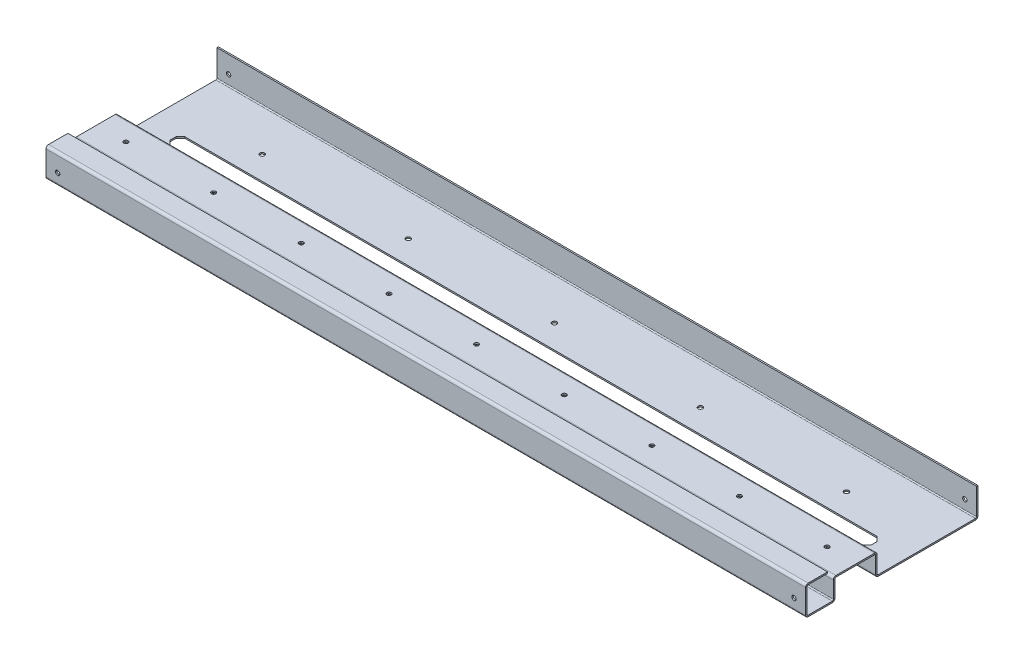
from build123d import *

# Parameters (mm, degrees)
SKETCH2_W                     = 520
SKETCH2_H                     = 70
BASE_FLANGE1_DEPTH            = 1
EDGE_FLANGE4_STRIP_W          = 5.4732
EDGE_FLANGE4_STRIP_H          = 1
EDGE_FLANGE4_STRIP_CUT_DEPTH  = 520
EDGE_FLANGE4_DEPTH            = 520
EDGE_FLANGE5_STRIP_W          = 5.4732
EDGE_FLANGE5_STRIP_H          = 1
EDGE_FLANGE5_STRIP_CUT_DEPTH  = 520
EDGE_FLANGE5_DEPTH            = 520
EDGE_FLANGE6_STRIP_W          = 5.4732
EDGE_FLANGE6_STRIP_H          = 1
EDGE_FLANGE6_STRIP_CUT_DEPTH  = 520
EDGE_FLANGE6_DEPTH            = 520
EDGE_FLANGE7_STRIP_W          = 5.4732
EDGE_FLANGE7_STRIP_H          = 1
EDGE_FLANGE7_STRIP_CUT_DEPTH  = 520
EDGE_FLANGE7_DEPTH            = 520
EDGE_FLANGE8_STRIP_W          = 5.4732
EDGE_FLANGE8_STRIP_H          = 1
EDGE_FLANGE8_STRIP_CUT_DEPTH  = 520
EDGE_FLANGE8_DEPTH            = 520
EDGE_FLANGE9_STRIP_W          = 5.4732
EDGE_FLANGE9_STRIP_H          = 1
EDGE_FLANGE9_STRIP_CUT_DEPTH  = 520
EDGE_FLANGE9_DEPTH            = 520
CUT_EXTRUDE2_REACH            = 527.071
CUT_EXTRUDE3_REACH            = 527.071
SKETCH38_R                    = 1.6
EDGE_FLANGE10_STRIP_W         = 5.4732
EDGE_FLANGE10_STRIP_H         = 1
EDGE_FLANGE10_STRIP_CUT_DEPTH = 520
EDGE_FLANGE10_DEPTH           = 520
HOLE1_START                   = 47
HOLE1_OUTLINE_R               = 1.5
HOLE1_DEPTH                   = 1
HOLE2_START                   = 47
HOLE2_OUTLINE_R               = 1.5
HOLE2_DEPTH                   = 1
HOLE3_START                   = -70
HOLE3_OUTLINE_R               = 1.5
HOLE3_DEPTH                   = 1
HOLE4_START                   = -70
HOLE4_OUTLINE_R               = 1.5
HOLE4_DEPTH                   = 1
SKETCH47_R                    = 1.5
CUT_EXTRUDE4_DEPTH            = 3


# Read off the part's stored shape, not the designer's step: Hole1, Hole2, Hole3, Hole4
# Sheet-metal steps are written as plain solids
with BuildPart() as part:
    # Sketch2 → Base-Flange1 (new body)
    with BuildSketch(Plane(origin=(0, 0, 0), x_dir=(1, 0, 0), z_dir=(0, 1, 0))):
        with Locations((260, 35)):
            Rectangle(SKETCH2_W, SKETCH2_H)
    extrude(amount=-BASE_FLANGE1_DEPTH)

    # Edge-Flange4 strip (across the edge) → Edge-Flange4 strip cut (cut)
    with BuildSketch(Plane(origin=(0, 0, 0), x_dir=(0, 0, -1), z_dir=(1, 0, 0))):
        with Locations((-1, -0.5)):
            Rectangle(EDGE_FLANGE4_STRIP_W, EDGE_FLANGE4_STRIP_H)
    extrude(amount=EDGE_FLANGE4_STRIP_CUT_DEPTH, mode=Mode.SUBTRACT)

    # Edge-Flange4 section (across the edge) → Edge-Flange4 (add)
    with BuildSketch(Plane(origin=(0, 0, 0), x_dir=(0, 0, -1), z_dir=(1, 0, 0))):
        with BuildLine():
            Line((0, 0.7366), (0, 14))
            Line((0, 14), (1, 14))
            Line((1, 14), (1, 0.7366))
            ThreePointArc((1, 0.7366), (1.215745145, 0.215745145), (1.7366, 0))
            Line((1.7366, 0), (1.7366, -1))
            ThreePointArc((1.7366, -1), (0.508638364, -0.491361636), (0, 0.7366))
        make_face()
    extrude(amount=EDGE_FLANGE4_DEPTH)

    # Edge-Flange5 strip (across the edge) → Edge-Flange5 strip cut (cut)
    with BuildSketch(Plane(origin=(520, 14, 0), x_dir=(0, -1, 0), z_dir=(-1, 0, 0))):
        with Locations((-1, -0.5)):
            Rectangle(EDGE_FLANGE5_STRIP_W, EDGE_FLANGE5_STRIP_H)
    extrude(amount=EDGE_FLANGE5_STRIP_CUT_DEPTH, mode=Mode.SUBTRACT)

    # Edge-Flange5 section (across the edge) → Edge-Flange5 (add)
    with BuildSketch(Plane(origin=(520, 14, 0), x_dir=(0, -1, 0), z_dir=(-1, 0, 0))):
        with BuildLine():
            Line((0, 0.7366), (0, 29))
            Line((0, 29), (1, 29))
            Line((1, 29), (1, 0.7366))
            ThreePointArc((1, 0.7366), (1.215745145, 0.215745145), (1.7366, 0))
            Line((1.7366, 0), (1.7366, -1))
            ThreePointArc((1.7366, -1), (0.508638364, -0.491361636), (0, 0.7366))
        make_face()
    extrude(amount=EDGE_FLANGE5_DEPTH)

    # Edge-Flange6 strip (across the edge) → Edge-Flange6 strip cut (cut)
    with BuildSketch(Plane(origin=(520, 13, 29), x_dir=(0, 0, -1), z_dir=(-1, 0, 0))):
        with Locations((-1, -0.5)):
            Rectangle(EDGE_FLANGE6_STRIP_W, EDGE_FLANGE6_STRIP_H)
    extrude(amount=EDGE_FLANGE6_STRIP_CUT_DEPTH, mode=Mode.SUBTRACT)

    # Edge-Flange6 section (across the edge) → Edge-Flange6 (add)
    with BuildSketch(Plane(origin=(520, 13, 29), x_dir=(0, 0, -1), z_dir=(-1, 0, 0))):
        with BuildLine():
            Line((0, 0.7366), (0, 14))
            Line((0, 14), (1, 14))
            Line((1, 14), (1, 0.7366))
            ThreePointArc((1, 0.7366), (1.215745145, 0.215745145), (1.7366, 0))
            Line((1.7366, 0), (1.7366, -1))
            ThreePointArc((1.7366, -1), (0.508638364, -0.491361636), (0, 0.7366))
        make_face()
    extrude(amount=EDGE_FLANGE6_DEPTH)

    # Edge-Flange7 strip (across the edge) → Edge-Flange7 strip cut (cut)
    with BuildSketch(Plane(origin=(0, -1, 29), x_dir=(0, 1, 0), z_dir=(1, 0, 0))):
        with Locations((-1, -0.5)):
            Rectangle(EDGE_FLANGE7_STRIP_W, EDGE_FLANGE7_STRIP_H)
    extrude(amount=EDGE_FLANGE7_STRIP_CUT_DEPTH, mode=Mode.SUBTRACT)

    # Edge-Flange7 section (across the edge) → Edge-Flange7 (add)
    with BuildSketch(Plane(origin=(0, -1, 29), x_dir=(0, 1, 0), z_dir=(1, 0, 0))):
        with BuildLine():
            Line((0, 0.7366), (0, 19))
            Line((0, 19), (1, 19))
            Line((1, 19), (1, 0.7366))
            ThreePointArc((1, 0.7366), (1.215745145, 0.215745145), (1.7366, 0))
            Line((1.7366, 0), (1.7366, -1))
            ThreePointArc((1.7366, -1), (0.508638364, -0.491361636), (0, 0.7366))
        make_face()
    extrude(amount=EDGE_FLANGE7_DEPTH)

    # Edge-Flange8 strip (across the edge) → Edge-Flange8 strip cut (cut)
    with BuildSketch(Plane(origin=(0, 0, 48), x_dir=(0, 0, -1), z_dir=(1, 0, 0))):
        with Locations((-1, -0.5)):
            Rectangle(EDGE_FLANGE8_STRIP_W, EDGE_FLANGE8_STRIP_H)
    extrude(amount=EDGE_FLANGE8_STRIP_CUT_DEPTH, mode=Mode.SUBTRACT)

    # Edge-Flange8 section (across the edge) → Edge-Flange8 (add)
    with BuildSketch(Plane(origin=(0, 0, 48), x_dir=(0, 0, -1), z_dir=(1, 0, 0))):
        with BuildLine():
            Line((0, 0.7366), (0, 19))
            Line((0, 19), (1, 19))
            Line((1, 19), (1, 0.7366))
            ThreePointArc((1, 0.7366), (1.215745145, 0.215745145), (1.7366, 0))
            Line((1.7366, 0), (1.7366, -1))
            ThreePointArc((1.7366, -1), (0.508638364, -0.491361636), (0, 0.7366))
        make_face()
    extrude(amount=EDGE_FLANGE8_DEPTH)

    # Edge-Flange9 strip (across the edge) → Edge-Flange9 strip cut (cut)
    with BuildSketch(Plane(origin=(0, 19, 47), x_dir=(0, -1, 0), z_dir=(1, 0, 0))):
        with Locations((-1, -0.5)):
            Rectangle(EDGE_FLANGE9_STRIP_W, EDGE_FLANGE9_STRIP_H)
    extrude(amount=EDGE_FLANGE9_STRIP_CUT_DEPTH, mode=Mode.SUBTRACT)

    # Edge-Flange9 section (across the edge) → Edge-Flange9 (add)
    with BuildSketch(Plane(origin=(0, 19, 47), x_dir=(0, -1, 0), z_dir=(1, 0, 0))):
        with BuildLine():
            Line((0, 0.7366), (0, 14))
            Line((0, 14), (1, 14))
            Line((1, 14), (1, 0.7366))
            ThreePointArc((1, 0.7366), (1.215745145, 0.215745145), (1.7366, 0))
            Line((1.7366, 0), (1.7366, -1))
            ThreePointArc((1.7366, -1), (0.508638364, -0.491361636), (0, 0.7366))
        make_face()
    extrude(amount=EDGE_FLANGE9_DEPTH)

    # Sketch37 → Cut-Extrude2 (cut, up to next)
    with BuildSketch(Plane(origin=(0, -1, 0), x_dir=(-1, 0, 0), z_dir=(0, -1, 0)), mode=Mode.PRIVATE) as cut_extrude2_sk1:
        Polygon((-497, 14), (-23, 14), (-20, 17), (-20, 21), (-23, 24), (-497, 24), (-500, 21), (-500, 17), align=None)
    cut_extrude2_tool1 = extrude(cut_extrude2_sk1.sketch, amount=-CUT_EXTRUDE2_REACH, mode=Mode.PRIVATE) & part.part
    add(cut_extrude2_tool1.solids().sort_by_distance((260, -1, -19))[0], mode=Mode.SUBTRACT)

    # Sketch38 → Cut-Extrude3 (cut, up to next)
    with BuildSketch(Plane.XZ.offset(1), mode=Mode.PRIVATE) as cut_extrude3_sk1:
        with Locations(Location((60, -40, 0), (0, 0, 270))):
            Circle(SKETCH38_R)
    cut_extrude3_tool1 = extrude(cut_extrude3_sk1.sketch, amount=-CUT_EXTRUDE3_REACH, mode=Mode.PRIVATE) & part.part
    # Sketch38 → Cut-Extrude3 (cut, up to next)
    with BuildSketch(Plane.XZ.offset(1), mode=Mode.PRIVATE) as cut_extrude3_sk2:
        with Locations(Location((160, -40, 0), (0, 0, 270))):
            Circle(SKETCH38_R)
    cut_extrude3_tool2 = extrude(cut_extrude3_sk2.sketch, amount=-CUT_EXTRUDE3_REACH, mode=Mode.PRIVATE) & part.part
    # Sketch38 → Cut-Extrude3 (cut, up to next)
    with BuildSketch(Plane.XZ.offset(1), mode=Mode.PRIVATE) as cut_extrude3_sk3:
        with Locations(Location((260, -40, 0), (0, 0, 270))):
            Circle(SKETCH38_R)
    cut_extrude3_tool3 = extrude(cut_extrude3_sk3.sketch, amount=-CUT_EXTRUDE3_REACH, mode=Mode.PRIVATE) & part.part
    # Sketch38 → Cut-Extrude3 (cut, up to next)
    with BuildSketch(Plane.XZ.offset(1), mode=Mode.PRIVATE) as cut_extrude3_sk4:
        with Locations(Location((360, -40, 0), (0, 0, 270))):
            Circle(SKETCH38_R)
    cut_extrude3_tool4 = extrude(cut_extrude3_sk4.sketch, amount=-CUT_EXTRUDE3_REACH, mode=Mode.PRIVATE) & part.part
    # Sketch38 → Cut-Extrude3 (cut, up to next)
    with BuildSketch(Plane.XZ.offset(1), mode=Mode.PRIVATE) as cut_extrude3_sk5:
        with Locations(Location((460, -40, 0), (0, 0, 270))):
            Circle(SKETCH38_R)
    cut_extrude3_tool5 = extrude(cut_extrude3_sk5.sketch, amount=-CUT_EXTRUDE3_REACH, mode=Mode.PRIVATE) & part.part
    add(cut_extrude3_tool1.solids().sort_by_distance((60, -1, -40))[0], mode=Mode.SUBTRACT)
    add(cut_extrude3_tool2.solids().sort_by_distance((160, -1, -40))[0], mode=Mode.SUBTRACT)
    add(cut_extrude3_tool3.solids().sort_by_distance((260, -1, -40))[0], mode=Mode.SUBTRACT)
    add(cut_extrude3_tool4.solids().sort_by_distance((360, -1, -40))[0], mode=Mode.SUBTRACT)
    add(cut_extrude3_tool5.solids().sort_by_distance((460, -1, -40))[0], mode=Mode.SUBTRACT)

    # Edge-Flange10 strip (across the edge) → Edge-Flange10 strip cut (cut)
    with BuildSketch(Plane(origin=(520, 0, -70), x_dir=(0, 0, 1), z_dir=(-1, 0, 0))):
        with Locations((-1, -0.5)):
            Rectangle(EDGE_FLANGE10_STRIP_W, EDGE_FLANGE10_STRIP_H)
    extrude(amount=EDGE_FLANGE10_STRIP_CUT_DEPTH, mode=Mode.SUBTRACT)

    # Edge-Flange10 section (across the edge) → Edge-Flange10 (add)
    with BuildSketch(Plane(origin=(520, 0, -70), x_dir=(0, 0, 1), z_dir=(-1, 0, 0))):
        with BuildLine():
            Line((0, 0.7366), (0, 18.7366))
            Line((0, 18.7366), (1, 18.7366))
            Line((1, 18.7366), (1, 0.7366))
            ThreePointArc((1, 0.7366), (1.215745145, 0.215745145), (1.7366, 0))
            Line((1.7366, 0), (1.7366, -1))
            ThreePointArc((1.7366, -1), (0.508638364, -0.491361636), (0, 0.7366))
        make_face()
    extrude(amount=EDGE_FLANGE10_DEPTH)

    # Hole1 outline → Hole1 (cut)
    with BuildSketch(Plane.XY.offset(HOLE1_START)):
        with Locations((8, 7)):
            Circle(HOLE1_OUTLINE_R)
    extrude(amount=HOLE1_DEPTH, mode=Mode.SUBTRACT)

    # Hole2 outline → Hole2 (cut)
    with BuildSketch(Plane.XY.offset(HOLE2_START)):
        with Locations((512, 7)):
            Circle(HOLE2_OUTLINE_R)
    extrude(amount=HOLE2_DEPTH, mode=Mode.SUBTRACT)

    # Hole3 outline → Hole3 (cut)
    with BuildSketch(Plane.XY.offset(HOLE3_START)):
        with Locations((512, 7)):
            Circle(HOLE3_OUTLINE_R)
    extrude(amount=HOLE3_DEPTH, mode=Mode.SUBTRACT)

    # Hole4 outline → Hole4 (cut)
    with BuildSketch(Plane.XY.offset(HOLE4_START)):
        with Locations((8, 7)):
            Circle(HOLE4_OUTLINE_R)
    extrude(amount=HOLE4_DEPTH, mode=Mode.SUBTRACT)

    # Sketch47 → Cut-Extrude4 (cut)
    with BuildSketch(Plane(origin=(0, 13, 0), x_dir=(-1, 0, 0), z_dir=(0, -1, 0))):
        with Locations(Location((-500, -13.2634, 0), (0, 0, 90))):
            Circle(SKETCH47_R)
        with Locations(Location((-440, -13.2634, 0), (0, 0, 90))):
            Circle(SKETCH47_R)
        with Locations(Location((-380, -13.2634, 0), (0, 0, 90))):
            Circle(SKETCH47_R)
        with Locations(Location((-320, -13.2634, 0), (0, 0, 90))):
            Circle(SKETCH47_R)
        with Locations(Location((-260, -13.2634, 0), (0, 0, 90))):
            Circle(SKETCH47_R)
        with Locations(Location((-200, -13.2634, 0), (0, 0, 90))):
            Circle(SKETCH47_R)
        with Locations(Location((-140, -13.2634, 0), (0, 0, 90))):
            Circle(SKETCH47_R)
        with Locations(Location((-80, -13.2634, 0), (0, 0, 90))):
            Circle(SKETCH47_R)
        with Locations(Location((-20, -13.2634, 0), (0, 0, 90))):
            Circle(SKETCH47_R)
    extrude(amount=-CUT_EXTRUDE4_DEPTH, mode=Mode.SUBTRACT)


solid = part.part
